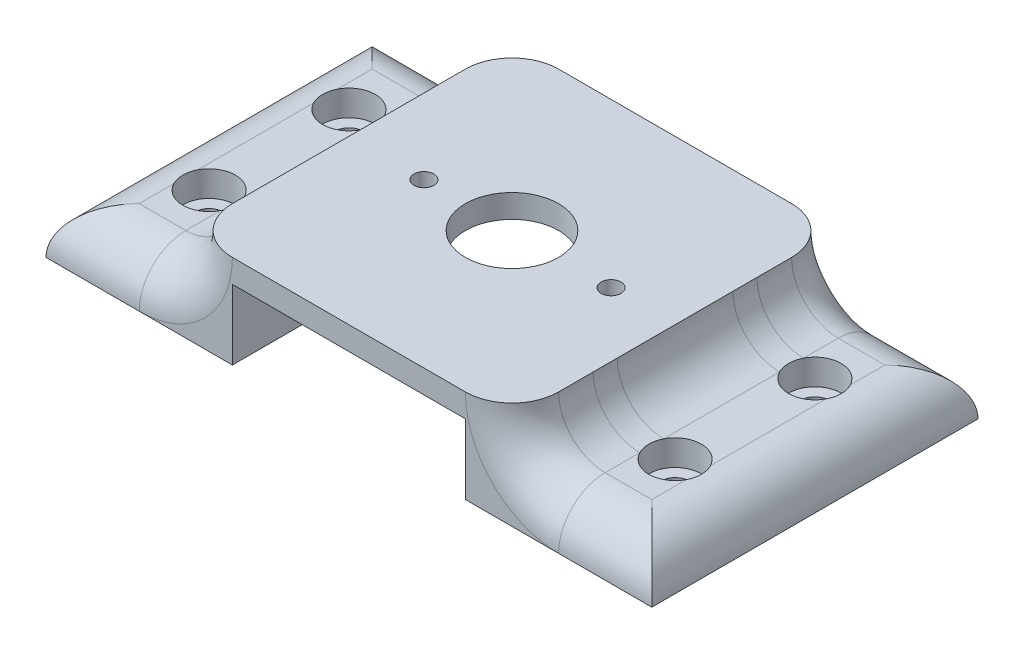
from build123d import *

# Parameters (mm, degrees)
BOSS_EXTRUDE1_DEPTH                            = 44.45
SKETCH2_R                                      = 6.35
CUT_EXTRUDE1_DEPTH                             = 44.45
CBORE_FOR_6_SOCKET_HEAD_CAP_SCREW1_D           = 3.7973
CBORE_FOR_6_SOCKET_HEAD_CAP_SCREW1_CBORE_D     = 7.14502
CBORE_FOR_6_SOCKET_HEAD_CAP_SCREW1_CBORE_DEPTH = 3.5052
F_6_32_TAPPED_HOLE1_D                          = 2.7051
F_6_32_TAPPED_HOLE1_DEPTH                      = 12.954
F_6_32_TAPPED_HOLE1_TIP                        = 0.81269403
FILLET1_R                                      = 6.35


# Some blends are built 0.0001 mm under size
with BuildPart() as part:
    # Sketch1 → Boss-Extrude1 (new body)
    with BuildSketch(Plane.XY):
        Polygon((-41.275, 0), (-41.275, 6.35), (-22.225, 6.35), (-22.225, 12.7), (22.225, 12.7), (22.225, 6.35), (41.275, 6.35), (41.275, 0), (15.875, 0), (15.875, 6.35), (15.875, 9.525), (-15.875, 9.525), (-15.875, 6.35), (-15.875, 0), align=None)
    extrude(amount=BOSS_EXTRUDE1_DEPTH)

    # Sketch2 → Cut-Extrude1 (cut)
    with BuildSketch(Plane(origin=(0, 12.7, 0), x_dir=(1, 0, 0), z_dir=(0, 1, 0))):
        with Locations(Location((0, -22.225, 0), (0, 0, 180))):
            Circle(SKETCH2_R)
    extrude(amount=-CUT_EXTRUDE1_DEPTH, mode=Mode.SUBTRACT)

    # CBORE for #6 Socket Head Cap Screw1 (through all)
    with Locations(Plane(origin=(31.75, 6.35, 31.75), x_dir=(0, 0, 1), z_dir=(0, 1, 0))):
        with Locations((0, 0), (-19.05, 0), (0, -63.5), (-19.05, -63.5)):
            CounterBoreHole(CBORE_FOR_6_SOCKET_HEAD_CAP_SCREW1_D / 2, CBORE_FOR_6_SOCKET_HEAD_CAP_SCREW1_CBORE_D / 2, CBORE_FOR_6_SOCKET_HEAD_CAP_SCREW1_CBORE_DEPTH)

    # #6-32 Tapped Hole1
    with Locations(Plane(origin=(-11.999976, 12.7, 22.225), x_dir=(1, 0, 0), z_dir=(0, 1, 0))):
        with Locations((0, 0), (25.500076, 0)):
            Hole(F_6_32_TAPPED_HOLE1_D / 2, depth=F_6_32_TAPPED_HOLE1_DEPTH)
            with Locations((0, 0, -(F_6_32_TAPPED_HOLE1_DEPTH + F_6_32_TAPPED_HOLE1_TIP / 2))):  # 118° drill point
                Cone(0, F_6_32_TAPPED_HOLE1_D / 2, F_6_32_TAPPED_HOLE1_TIP, mode=Mode.SUBTRACT)

    # Fillet1
    fillet1_edges = [part.edges().sort_by_distance(p)[0] for p in [
        (-22.225, 6.35, 22.225),
        (22.225, 6.35, 22.225),
    ]]
    fillet(fillet1_edges, radius=FILLET1_R - 0.0001)  # a hair under: the kernel refuses the full size
    # the kernel refuses this fillet: 6.35 mm, written as the material it takes off along each edge
    with BuildSketch(Plane(origin=(-57.15, 6.35, 0), x_dir=(0, 0, 1), z_dir=(1, 0, 0)), Plane(origin=(28.5749, 6.35, 44.45), x_dir=(0, -1, 0), z_dir=(1, 0, 0))) as fillet1_2_piece_1:
        with BuildLine():
            CenterArc((FILLET1_R, FILLET1_R), FILLET1_R, 180, 90)
            Line((0, FILLET1_R), (-FILLET1_R * 0.02, FILLET1_R))
            Line((-FILLET1_R * 0.02, FILLET1_R), (-FILLET1_R * 0.02, -FILLET1_R * 0.02))
            Line((-FILLET1_R * 0.02, -FILLET1_R * 0.02), (FILLET1_R, -FILLET1_R * 0.02))
            Line((FILLET1_R, -FILLET1_R * 0.02), (FILLET1_R, 0))
        make_face()
    extrude(amount=28.5751, mode=Mode.SUBTRACT)
    with BuildSketch(Plane(origin=(28.5749, 6.35, 0), x_dir=(0, -1, 0), z_dir=(1, 0, 0)), Plane(origin=(-57.15, 6.35, 44.45), x_dir=(0, 0, -1), z_dir=(1, 0, 0))) as fillet1_2_piece_2:
        with BuildLine():
            CenterArc((FILLET1_R, -FILLET1_R), FILLET1_R, 90, 90)
            Line((0, -FILLET1_R), (-FILLET1_R * 0.02, -FILLET1_R))
            Line((-FILLET1_R * 0.02, -FILLET1_R), (-FILLET1_R * 0.02, FILLET1_R * 0.02))
            Line((-FILLET1_R * 0.02, FILLET1_R * 0.02), (FILLET1_R, FILLET1_R * 0.02))
            Line((FILLET1_R, FILLET1_R * 0.02), (FILLET1_R, 0))
        make_face()
    extrude(amount=28.5751, mode=Mode.SUBTRACT)
    with BuildSketch(Plane(origin=(41.275, 6.35, -15.875), x_dir=(-1, 0, 0), z_dir=(0, 0, 1))) as fillet1_2_piece_3:
        with BuildLine():
            CenterArc((FILLET1_R, FILLET1_R), FILLET1_R, 180, 90)
            Line((0, FILLET1_R), (-FILLET1_R * 0.02, FILLET1_R))
            Line((-FILLET1_R * 0.02, FILLET1_R), (-FILLET1_R * 0.02, -FILLET1_R * 0.02))
            Line((-FILLET1_R * 0.02, -FILLET1_R * 0.02), (FILLET1_R, -FILLET1_R * 0.02))
            Line((FILLET1_R, -FILLET1_R * 0.02), (FILLET1_R, 0))
        make_face()
    extrude(amount=76.2, mode=Mode.SUBTRACT)
    with BuildSketch(Plane(origin=(-41.275, 6.35, -15.875), x_dir=(1, 0, 0), z_dir=(0, 0, 1))) as fillet1_2_piece_4:
        with BuildLine():
            CenterArc((FILLET1_R, -FILLET1_R), FILLET1_R, 90, 90)
            Line((0, -FILLET1_R), (-FILLET1_R * 0.02, -FILLET1_R))
            Line((-FILLET1_R * 0.02, -FILLET1_R), (-FILLET1_R * 0.02, FILLET1_R * 0.02))
            Line((-FILLET1_R * 0.02, FILLET1_R * 0.02), (FILLET1_R, FILLET1_R * 0.02))
            Line((FILLET1_R, FILLET1_R * 0.02), (FILLET1_R, 0))
        make_face()
    extrude(amount=76.2, mode=Mode.SUBTRACT)
    with BuildSketch(Plane(origin=(28.5749, 12.6999, 44.45), x_dir=(0.8017677787065368, 0.5976356992583242, 0), z_dir=(0.5976356992583242, -0.8017677787065368, 0))) as fillet1_2_piece_5:
        with BuildLine():
            CenterArc((6.3499 + FILLET1_R, -FILLET1_R), FILLET1_R, 90, 90)
            Line((6.3499, -FILLET1_R), (6.3499 - FILLET1_R * 0.02, -FILLET1_R))
            Line((6.3499 - FILLET1_R * 0.02, -FILLET1_R), (6.3499 - FILLET1_R * 0.02, FILLET1_R * 0.02))
            Line((6.3499 - FILLET1_R * 0.02, FILLET1_R * 0.02), (6.3499 + FILLET1_R, FILLET1_R * 0.02))
            Line((6.3499 + FILLET1_R, FILLET1_R * 0.02), (6.3499 + FILLET1_R, 0))
        make_face()
    revolve(axis=Axis((28.5749, 12.6999, 44.45), (0, 0, 1)), revolution_arc=233.299245918, mode=Mode.SUBTRACT)
    with BuildSketch(Plane(origin=(-28.5749, 12.6999, 44.45), x_dir=(0, -1, 0), z_dir=(-1, 0, 0))) as fillet1_2_piece_6:
        with BuildLine():
            CenterArc((6.3499 + FILLET1_R, -FILLET1_R), FILLET1_R, 90, 90)
            Line((6.3499, -FILLET1_R), (6.3499 - FILLET1_R * 0.02, -FILLET1_R))
            Line((6.3499 - FILLET1_R * 0.02, -FILLET1_R), (6.3499 - FILLET1_R * 0.02, FILLET1_R * 0.02))
            Line((6.3499 - FILLET1_R * 0.02, FILLET1_R * 0.02), (6.3499 + FILLET1_R, FILLET1_R * 0.02))
            Line((6.3499 + FILLET1_R, FILLET1_R * 0.02), (6.3499 + FILLET1_R, 0))
        make_face()
    revolve(axis=Axis((-28.5749, 12.6999, 44.45), (0, 0, 1)), revolution_arc=233.299245918, mode=Mode.SUBTRACT)
    with BuildSketch(Plane(origin=(28.5749, 12.6999, 0), x_dir=(0.8017677787065365, 0.5976356992583244, 0), z_dir=(0.5976356992583244, -0.8017677787065365, 0))) as fillet1_2_piece_7:
        with BuildLine():
            CenterArc((6.3499 + FILLET1_R, FILLET1_R), FILLET1_R, 180, 90)
            Line((6.3499, FILLET1_R), (6.3499 - FILLET1_R * 0.02, FILLET1_R))
            Line((6.3499 - FILLET1_R * 0.02, FILLET1_R), (6.3499 - FILLET1_R * 0.02, -FILLET1_R * 0.02))
            Line((6.3499 - FILLET1_R * 0.02, -FILLET1_R * 0.02), (6.3499 + FILLET1_R, -FILLET1_R * 0.02))
            Line((6.3499 + FILLET1_R, -FILLET1_R * 0.02), (6.3499 + FILLET1_R, 0))
        make_face()
    revolve(axis=Axis((28.5749, 12.6999, 0), (0, 0, 1)), revolution_arc=233.299245918, mode=Mode.SUBTRACT)
    with BuildSketch(Plane(origin=(-28.5749, 12.6999, 0), x_dir=(0, -1, 0), z_dir=(-1, 0, 0))) as fillet1_2_piece_8:
        with BuildLine():
            CenterArc((6.3499 + FILLET1_R, FILLET1_R), FILLET1_R, 180, 90)
            Line((6.3499, FILLET1_R), (6.3499 - FILLET1_R * 0.02, FILLET1_R))
            Line((6.3499 - FILLET1_R * 0.02, FILLET1_R), (6.3499 - FILLET1_R * 0.02, -FILLET1_R * 0.02))
            Line((6.3499 - FILLET1_R * 0.02, -FILLET1_R * 0.02), (6.3499 + FILLET1_R, -FILLET1_R * 0.02))
            Line((6.3499 + FILLET1_R, -FILLET1_R * 0.02), (6.3499 + FILLET1_R, 0))
        make_face()
    revolve(axis=Axis((-28.5749, 12.6999, 0), (0, 0, 1)), revolution_arc=233.299245918, mode=Mode.SUBTRACT)


solid = part.part
